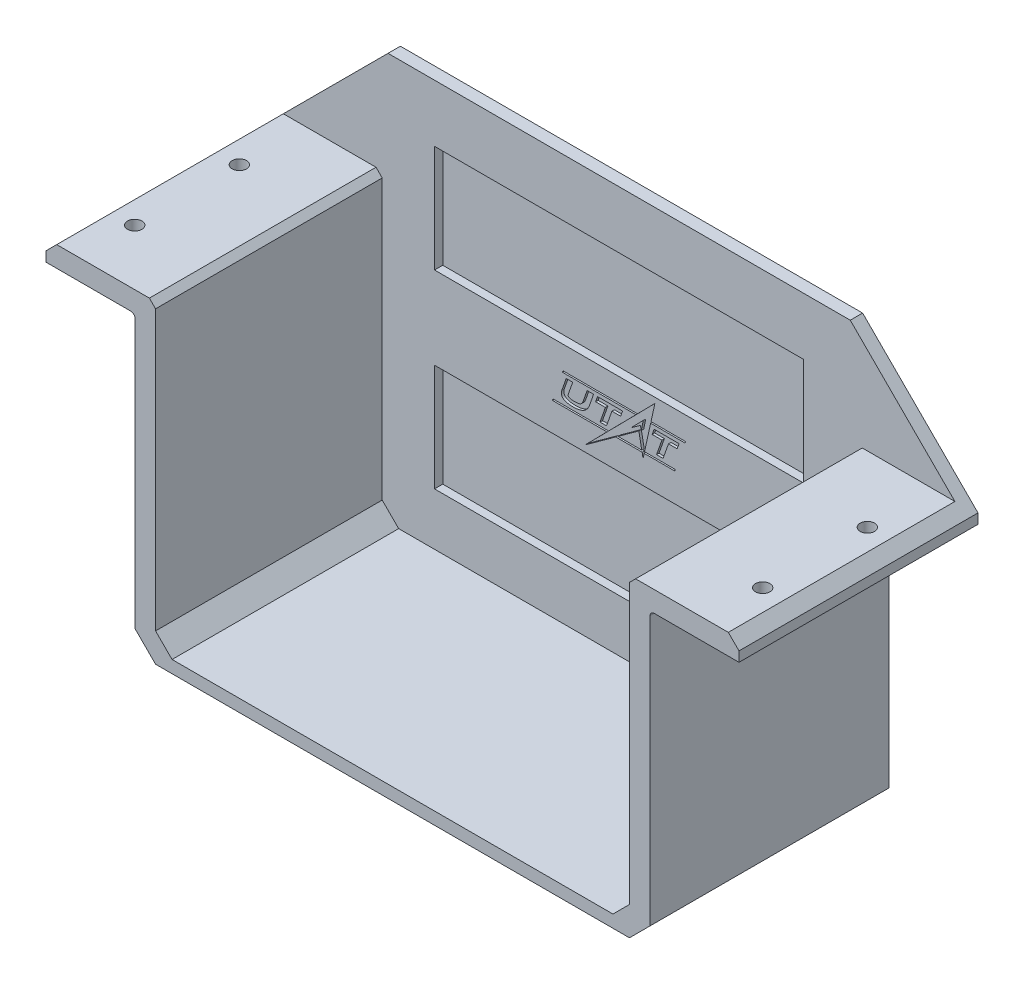
from build123d import *

# Parameters (mm, degrees)
SKETCH1_W           = 125
SKETCH1_H           = 76.2
BOSS_EXTRUDE1_DEPTH = 3
SKETCH2_W           = 5
SKETCH2_H           = 76.2
BOSS_EXTRUDE2_DEPTH = 55
SKETCH4_W           = 58
SKETCH4_H           = 5
BOSS_EXTRUDE4_DEPTH = 21.59
SKETCH5_W           = 58
SKETCH5_H           = 5
BOSS_EXTRUDE5_DEPTH = 21.59
SKETCH6_W           = 168.18
SKETCH6_H           = 25.4
BOSS_EXTRUDE6_DEPTH = 3
CHAMFER1_SIZE       = 28
SKETCH7_W           = 89.6
SKETCH7_H           = 26
CUT_EXTRUDE1_DEPTH  = 2
SKETCH9_W           = 115
SKETCH9_H           = 3
BOSS_EXTRUDE7_DEPTH = 55
CHAMFER2_SIZE       = 4
CHAMFER3_SIZE       = 5
CUT_EXTRUDE2_START  = -0.6
CUT_EXTRUDE2_DEPTH  = 0.6
SKETCH11_R          = 1.75
CUT_EXTRUDE3_DEPTH  = 5
SKETCH12_R          = 1.75
CUT_EXTRUDE4_DEPTH  = 5
FILLET1_R           = 1
CHAMFER4_SIZE       = 1.5


# Read off the part's stored shape, not the designer's step: Cut-Extrude2
with BuildPart() as part:
    # Sketch1 → Boss-Extrude1 (new body)
    with BuildSketch(Plane.XY):
        Rectangle(SKETCH1_W, SKETCH1_H)
    extrude(amount=BOSS_EXTRUDE1_DEPTH)

    # Sketch2 → Boss-Extrude2 (add)
    with BuildSketch(Plane.XY.offset(3)):
        with Locations((-60, 0)):
            Rectangle(SKETCH2_W, SKETCH2_H)
        with Locations((60, 0)):
            Rectangle(SKETCH2_W, SKETCH2_H)
    extrude(amount=BOSS_EXTRUDE2_DEPTH)

    # Sketch4 → Boss-Extrude4 (add)
    with BuildSketch(Plane.ZY.offset(62.5)):
        with Locations((29, 35.6)):
            Rectangle(SKETCH4_W, SKETCH4_H)
    extrude(amount=BOSS_EXTRUDE4_DEPTH)

    # Sketch5 → Boss-Extrude5 (add)
    with BuildSketch(Plane(origin=(62.5, 0, 0), x_dir=(0, 0, -1), z_dir=(1, 0, 0))):
        with Locations((-29, 35.6)):
            Rectangle(SKETCH5_W, SKETCH5_H)
    extrude(amount=BOSS_EXTRUDE5_DEPTH)

    # Sketch6 → Boss-Extrude6 (add)
    with BuildSketch(Plane(origin=(0, 0, 0), x_dir=(-1, 0, 0), z_dir=(0, 0, -1))):
        with Locations((0, 50.8)):
            Rectangle(SKETCH6_W, SKETCH6_H)
    extrude(amount=-BOSS_EXTRUDE6_DEPTH)

    # Chamfer1
    chamfer1_edges = [part.edges().sort_by_distance(p)[0] for p in [
        (-84.09, 63.5, 1.5),
        (84.09, 63.5, 1.5),
    ]]
    chamfer(chamfer1_edges, length=CHAMFER1_SIZE)

    # Sketch7 → Cut-Extrude1 (cut)
    with BuildSketch(Plane.XY.offset(3)):
        with Locations((0, -9.4)):
            Rectangle(SKETCH7_W, SKETCH7_H)
        with Locations((0, 36.6)):
            Rectangle(SKETCH7_W, SKETCH7_H)
    extrude(amount=-CUT_EXTRUDE1_DEPTH, mode=Mode.SUBTRACT)

    # Sketch9 → Boss-Extrude7 (add)
    with BuildSketch(Plane.XY.offset(3)):
        with Locations((0, -36.6)):
            Rectangle(SKETCH9_W, SKETCH9_H)
    extrude(amount=BOSS_EXTRUDE7_DEPTH)

    # Chamfer2
    chamfer2_edges = [part.edges().sort_by_distance(p)[0] for p in [
        (-57.5, -35.1, 30.5),
        (57.5, -35.1, 30.5),
    ]]
    chamfer(chamfer2_edges, length=CHAMFER2_SIZE)

    # Chamfer3
    chamfer3_edges = [part.edges().sort_by_distance(p)[0] for p in [
        (62.5, -38.1, 29),
        (-62.5, -38.1, 29),
    ]]
    chamfer(chamfer3_edges, length=CHAMFER3_SIZE)

    # Cut-Extrude2 outline → Cut-Extrude2 (cut)
    # profile 1 of 4: a face of its own
    with BuildSketch(Plane.XY.offset(3).offset(CUT_EXTRUDE2_START)):
        with BuildLine():
            Line((-12.843793417, 16.784775128), (-13.918894641, 13.722312614))
            add(Edge.make_bspline(
                [(-13.918894641, 13.722312614), (-13.950745906, 13.608646354), (-13.97919001, 13.483685694), (-14.011317489, 13.235305925), (-14.01541758, 13.110841548), (-13.989547543, 12.867284383), (-13.959604678, 12.747961158), (-13.857332343, 12.519974586), (-13.78490702, 12.411398187), (-13.592313629, 12.212018271), (-13.472083062, 12.121314997), (-13.184369222, 11.962818623), (-13.016909084, 11.895027419), (-12.454211206, 11.728033285), (-11.997806272, 11.664794493), (-11.025815686, 11.62704002), (-10.511530183, 11.651603075), (-9.78258436, 11.770518687), (-9.546683753, 11.824200176), (-9.102156978, 11.962599668), (-8.89364967, 12.047436893), (-8.514064046, 12.246658938), (-8.343153207, 12.361026326), (-8.04132547, 12.611058926), (-7.910418089, 12.746448479), (-7.679883041, 13.0275306), (-7.579636344, 13.172799488), (-7.44297026, 13.39668043), (-7.39971151, 13.472431032), (-7.318663078, 13.627460279), (-7.280772846, 13.706786212), (-7.248185858, 13.788667895)],
                knots=[0, 0, 0, 0, 0.0625, 0.0625, 0.125, 0.125, 0.1875, 0.1875, 0.25, 0.25, 0.3125, 0.3125, 0.375, 0.375, 0.5, 0.5, 0.625, 0.625, 0.6875, 0.6875, 0.75, 0.75, 0.8125, 0.8125, 0.875, 0.875, 0.9375, 0.9375, 0.96875, 0.96875, 1, 1, 1, 1], degree=3))
            Line((-7.248185858, 13.788667895), (-6.196379448, 16.784775128))
            Line((-6.196379448, 16.784775128), (-7.771512854, 16.784775171))
            Line((-7.771512854, 16.784775171), (-8.779640442, 13.913087848))
            add(Edge.make_bspline(
                [(-8.779640442, 13.913087848), (-8.801212863, 13.867686768), (-8.828630281, 13.811426743), (-8.890437912, 13.684919137), (-8.925723343, 13.615289873), (-9.014867696, 13.477778317), (-9.069034752, 13.410065742), (-9.20356673, 13.286811644), (-9.283951715, 13.231246188), (-9.470687062, 13.136081945), (-9.576947425, 13.096402347), (-9.809000897, 13.032201026), (-9.934689567, 13.00760449), (-10.326953956, 12.952228061), (-10.607716868, 12.939250309), (-11.138236784, 12.940792557), (-11.387946526, 12.95495502), (-11.815776289, 13.010911905), (-11.994686961, 13.05312605), (-12.19022456, 13.154353945), (-12.243244201, 13.194586759), (-12.322270156, 13.289978248), (-12.348136332, 13.345299657), (-12.373130151, 13.46826163), (-12.371956966, 13.5361378), (-12.35254935, 13.67085438), (-12.333771283, 13.737944141), (-12.322165603, 13.788667937)],
                knots=[0, 0, 0, 0, 0.0625, 0.0625, 0.125, 0.125, 0.1875, 0.1875, 0.25, 0.25, 0.3125, 0.3125, 0.375, 0.375, 0.5, 0.5, 0.625, 0.625, 0.75, 0.75, 0.8125, 0.8125, 0.875, 0.875, 0.9375, 0.9375, 1, 1, 1, 1], degree=3))
            Line((-12.322165603, 13.788667937), (-11.2703582, 16.784775128))
            Line((-11.2703582, 16.784775128), (-12.843793417, 16.784775128))
        make_face()
    # profile 2 of 4: a face of its own
    with BuildSketch(Plane.XY.offset(3).offset(CUT_EXTRUDE2_START)):
        Polygon((14.082145905, 15.466432145), (14.547318434, 16.784775128), (8.481425261, 16.784775128), (8.015662645, 15.45803385), (10.386127447, 15.45803385), (9.075451111, 11.743439605), (10.661733364, 11.743439605), (11.975372051, 15.466432145), align=None)
    # profile 3 of 4: a face of its own
    with BuildSketch(Plane.XY.offset(3).offset(CUT_EXTRUDE2_START)):
        Polygon((0.359928822, 15.45803385), (0.825593089, 16.784775128), (-5.237786258, 16.784775128), (-5.705919648, 15.45803385), (-3.328357423, 15.45803385), (-4.639000977, 11.723834147), (-3.059652234, 11.723834147), (-1.74900868, 15.45803385), align=None)
    # profile 4 of 4: a face of its own
    with BuildSketch(Plane.XY.offset(3).offset(CUT_EXTRUDE2_START)):
        Polygon((7.732615088, 18.009820452), (8.67993853, 22.298690548), (4.451236342, 18.010625114), (-13.617285872, 18.010625114), (-13.760696138, 17.631800344), (4.083976363, 17.631800344), (-2.561139847, 10.89339914), (-16.036862666, 10.89339914), (-16.175076152, 10.505618026), (-2.943552817, 10.505618026), (-8.264964605, 5.10950355), (-0.819885517, 10.505618026), (5.569839691, 10.505618026), (5.813932632, 9.32327198), (6.07620201, 10.510665049), (13.482070183, 10.510665049), (13.624063348, 10.89339914), (6.160742258, 10.89339914), (7.649117922, 17.631800344), (15.972876762, 17.631800344), (16.113123511, 18.009820452), align=None)
        Polygon((-0.283933962, 10.894070437), (4.780674194, 14.564845582), (5.489286994, 10.894070437), align=None, mode=Mode.SUBTRACT)
        Polygon((5.863139247, 17.323666682), (5.364033793, 14.945937564), (5.179256414, 15.9244998), (2.885975157, 14.289472868), align=None, mode=Mode.SUBTRACT)
    extrude(amount=CUT_EXTRUDE2_DEPTH, mode=Mode.SUBTRACT)

    # Sketch11 → Cut-Extrude3 (cut)
    with BuildSketch(Plane(origin=(0, 38.1, 0), x_dir=(1, 0, 0), z_dir=(0, 1, 0))):
        with Locations(Location((-76.11, -19.05, 0), (0, 0, 270))):
            Circle(SKETCH11_R)
        with Locations(Location((76.29, -19.05, 0), (0, 0, 270))):
            Circle(SKETCH11_R)
    extrude(amount=-CUT_EXTRUDE3_DEPTH, mode=Mode.SUBTRACT)

    # Sketch12 → Cut-Extrude4 (cut)
    with BuildSketch(Plane(origin=(0, 38.1, 0), x_dir=(1, 0, 0), z_dir=(0, 1, 0))):
        with Locations(Location((-76.11, -44.45, 0), (0, 0, 270))):
            Circle(SKETCH12_R)
        with Locations(Location((76.29, -44.45, 0), (0, 0, 270))):
            Circle(SKETCH12_R)
    extrude(amount=-CUT_EXTRUDE4_DEPTH, mode=Mode.SUBTRACT)

    # Fillet1
    fillet1_edges = [part.edges().sort_by_distance(p)[0] for p in [
        (-62.5, 33.1, 29),
        (62.5, 33.1, 29),
    ]]
    fillet(fillet1_edges, radius=FILLET1_R)

    # Chamfer4
    chamfer4_edges = [part.edges().sort_by_distance(p)[0] for p in [
        (-57.5, 38.1, 30.5),
        (57.5, 38.1, 30.5),
    ]]
    chamfer(chamfer4_edges, length=CHAMFER4_SIZE)


solid = part.part
